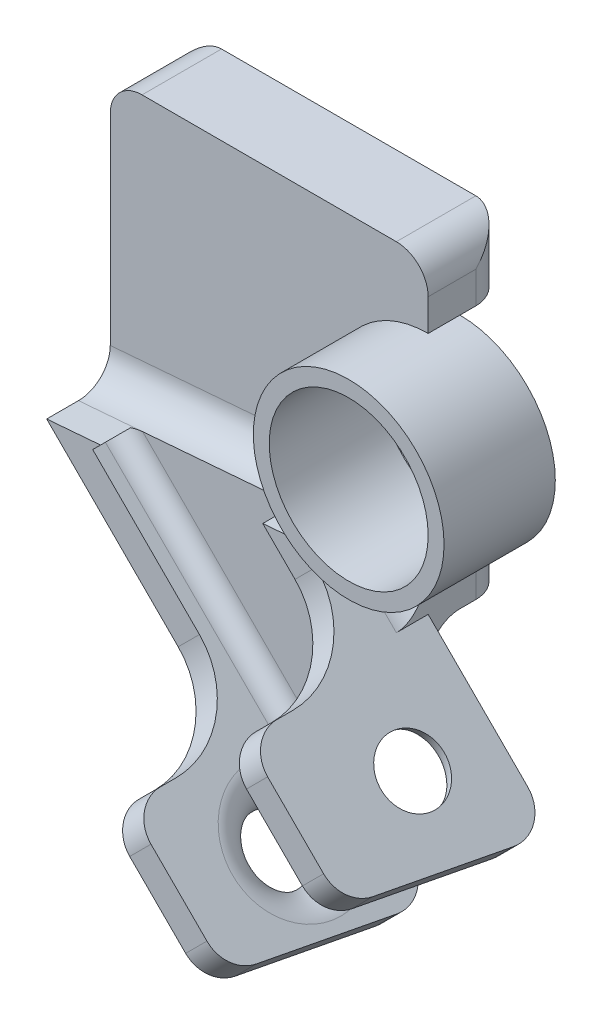
from build123d import *

# Parameters (mm, degrees)
CROQUIS1_R                   = 6
CROQUIS1_R_2                 = 5
SALIENTE_EXTRUIR1_DEPTH      = 7
SALIENTE_EXTRUIR2_DEPTH      = 3
SALIENTE_EXTRUIR2_DEPTH_BACK = 2
CROQUIS4_W                   = 20
CROQUIS4_H                   = 16.5
CORTAR_EXTRUIR1_DEPTH        = 4
SALIENTE_EXTRUIR7_DEPTH      = 4
CORTAR_EXTRUIR4_DEPTH        = 4
CORTAR_EXTRUIR5_DEPTH        = 2.2
SALIENTE_EXTRUIR9_DEPTH      = 8
CORTAR_EXTRUIR6_REACH        = 36.518
CROQUIS13_R                  = 2
REDONDEO1_R                  = 2
CROQUIS14_W                  = 1.8
CROQUIS14_H                  = 8.5
CORTAR_EXTRUIR7_DEPTH        = 10.5
CROQUIS15_W                  = 2
CROQUIS15_H                  = 8.5
CORTAR_EXTRUIR8_DEPTH        = 14.5
REDONDEO2_R                  = 2
REDONDEO3_R                  = 2
REDONDEO4_R                  = 5
CORTAR_EXTRUIR9_REACH        = 36.518
REDONDEO5_R                  = 2
REDONDEO6_R                  = 1.2
SALIENTE_EXTRUIR12_START     = 1
SALIENTE_EXTRUIR12_DEPTH     = 1
SALIENTE_EXTRUIR13_DEPTH     = 3
REDONDEO7_R                  = 2


with BuildPart() as part:
    # Croquis1 → Saliente-Extruir1 (new body)
    with BuildSketch(Plane.XY):
        Circle(CROQUIS1_R)
        Circle(CROQUIS1_R_2, mode=Mode.SUBTRACT)
    extrude(amount=SALIENTE_EXTRUIR1_DEPTH)

    # Croquis2 → Saliente-Extruir2 (add, two sides: drawn at the far end of the back side and taken through both)
    with BuildSketch(Plane(origin=(0, 0, 0), x_dir=(-1, 0, 0), z_dir=(0, 0, -1)).offset(-SALIENTE_EXTRUIR2_DEPTH_BACK)):
        with BuildLine():
            Line((0, -10), (0, -5))
            ThreePointArc((0, -5), (5, 0), (0, 5))
            Line((0, 5), (0, 10))
            Line((0, 10), (20, 10))
            Line((20, 10), (20, -10))
            Line((20, -10), (0, -10))
        make_face()
    extrude(amount=SALIENTE_EXTRUIR2_DEPTH + SALIENTE_EXTRUIR2_DEPTH_BACK)

    # Croquis4 → Cortar-Extruir1 (cut)
    with BuildSketch(Plane(origin=(0, 0, -3), x_dir=(-1, 0, 0), z_dir=(0, 0, -1))):
        with Locations((10, 0)):
            Rectangle(CROQUIS4_W, CROQUIS4_H)
    extrude(amount=-CORTAR_EXTRUIR1_DEPTH, mode=Mode.SUBTRACT)

    # Croquis5 → Saliente-Extruir7 (add)
    with BuildSketch(Plane.XY.offset(2)):
        Polygon((-3.9473557, -5.357801084), (-20, -6.659228144), (0.707205479, -27.366433624), (16.75984978, -26.065006564), align=None)
    extrude(amount=SALIENTE_EXTRUIR7_DEPTH)

    # Croquis10 → Cortar-Extruir4 (cut)
    with BuildSketch(Plane.XY.offset(6)):
        Polygon((-0.765202985, -25.894025159), (7.911832695, -17.216989479), (16.75984978, -26.065006564), (0.707205479, -27.366433624), align=None)
    extrude(amount=-CORTAR_EXTRUIR4_DEPTH, mode=Mode.SUBTRACT)

    # Croquis11 → Cortar-Extruir5 (cut)
    with BuildSketch(Plane.XY.offset(6)):
        Polygon((0.572064306, -24.556757867), (6.582471946, -18.546350227), (-0.842149256, -11.121729025), (-6.852556896, -17.132136665), align=None)
    extrude(amount=-CORTAR_EXTRUIR5_DEPTH, mode=Mode.SUBTRACT)

    # Croquis12 → Saliente-Extruir9 (add)
    with BuildSketch(Plane.XY.offset(6)):
        Polygon((-6.852556896, -17.132136665), (-8.189824188, -18.469403956), (-0.765202985, -25.894025159), (0.572064306, -24.556757867), align=None)
        Polygon((-0.842149256, -11.121729025), (0.487211492, -9.792368276), (7.911832695, -17.216989479), (6.582471946, -18.546350227), align=None)
    extrude(amount=SALIENTE_EXTRUIR9_DEPTH)

    # Cortar-Extruir6: up to this face of the body (flat: up to its plane)
    cortar_extruir6_end = Plane(part.part.faces().sort_by_distance((3.21499462, -12.520151404, 7.335855075))[0])
    # Croquis13 → Cortar-Extruir6 (cut, up to the picked face)
    with BuildSketch(Plane(origin=(-13.329614072, -13.329614072, 0), x_dir=(0, 0, 1), z_dir=(-0.7071067811865488, -0.7071067811865462, 0)), mode=Mode.PRIVATE) as cortar_extruir6_sk1:
        with Locations(Location((7, -12.268760562, 0), (0, 0, 270))):
            Circle(CROQUIS13_R)
    cortar_extruir6_tool1 = split(extrude(cortar_extruir6_sk1.sketch, amount=-CORTAR_EXTRUIR6_REACH, mode=Mode.PRIVATE), bisect_by=cortar_extruir6_end, keep=Keep.BOTH, mode=Mode.PRIVATE)
    add(cortar_extruir6_tool1.solids().sort_by(Axis((-4.65429, -22.004938, 7), (0.7071067811865488, 0.7071067811865462, 0)))[0], mode=Mode.SUBTRACT)

    # Redondeo1
    # the kernel refuses this fillet: 2 mm, written as the material it takes off along each edge
    with BuildSketch(Plane(origin=(-3.31702299, -20.667670571, 7), x_dir=(0.7071067811865459, -0.7071067811865492, 0), z_dir=(0, 0, -1))) as redondeo1_piece_1_section:
        with BuildLine():
            CenterArc((3.997037442, 2), REDONDEO1_R, 183.11895941, 86.88104059)
            Line((2, 1.89118154), (1.960059251, 1.889005171))
            ThreePointArc((1.960059251, 1.889005171), (1.96, 0.94559077), (1.96, 0))
            Line((1.96, 0), (2, -0.04))
            Line((2, -0.04), (3.997037442, -0.04))
            Line((3.997037442, -0.04), (3.997037442, 0))
        make_face()
    redondeo1_piece_1 = revolve(axis=Axis((-3.31702299, -20.667670571, 7), (-0.7071067811865488, -0.7071067811865462, 0)), mode=Mode.PRIVATE)
    redondeo1_piece_1 = split(redondeo1_piece_1, bisect_by=Plane(origin=(-3.31702299, -20.667670571, 3.8), z_dir=(0, 0, 1)), keep=Keep.TOP, mode=Mode.PRIVATE)
    add(redondeo1_piece_1, mode=Mode.SUBTRACT)
    with BuildSketch(Plane(origin=(2.69338465, -14.657262931, 7), x_dir=(0.7071067811865458, -0.7071067811865493, 0), z_dir=(0, 0, -1))) as redondeo1_piece_2_section:
        with BuildLine():
            CenterArc((3.996396754, -2), REDONDEO1_R, 90, 86.560187232)
            Line((3.996396754, 0), (3.996396754, 0.04))
            Line((3.996396754, 0.04), (2, 0.04))
            Line((2, 0.04), (1.96, 0))
            ThreePointArc((1.96, 0), (1.96, -0.94), (1.960072065, -1.8776))
            Line((1.960072065, -1.8776), (2, -1.88))
        make_face()
    redondeo1_piece_2 = revolve(axis=Axis((2.69338465, -14.657262931, 7), (-0.7071067811865488, -0.7071067811865462, 0)), mode=Mode.PRIVATE)
    redondeo1_piece_2 = split(redondeo1_piece_2, bisect_by=Plane(origin=(2.69338465, -14.657262931, 3.8), z_dir=(0, 0, 1)), keep=Keep.TOP, mode=Mode.PRIVATE)
    add(redondeo1_piece_2, mode=Mode.SUBTRACT)

    # Croquis14 → Cortar-Extruir7 (cut)
    with BuildSketch(Plane(origin=(12.564411087, -12.564411087, 0), x_dir=(0, 0, -1), z_dir=(0.7071067811865477, -0.7071067811865474, 0))):
        with Locations((-2.9, -12.709739462)):
            Rectangle(CROQUIS14_W, CROQUIS14_H)
    extrude(amount=-CORTAR_EXTRUIR7_DEPTH, mode=Mode.SUBTRACT)

    # Croquis15 → Cortar-Extruir8 (cut)
    with BuildSketch(Plane(origin=(5.139789884, -5.139789884, 0), x_dir=(0, 0, -1), z_dir=(0.7071067811865476, -0.7071067811865476, 0))):
        with Locations((-5, -12.709739462)):
            Rectangle(CROQUIS15_W, CROQUIS15_H)
    extrude(amount=-CORTAR_EXTRUIR8_DEPTH, mode=Mode.SUBTRACT)

    # Redondeo2
    # the kernel refuses this fillet: 2 mm, written as the material it adds along each edge
    with BuildSketch(Plane(origin=(-21.659228144, -10, 2), x_dir=(0, -1, 0), z_dir=(1, 0, 0))) as redondeo2_piece_1_section:
        with BuildLine():
            CenterArc((REDONDEO2_R, REDONDEO2_R), REDONDEO2_R, 180, 90)
            Line((0, REDONDEO2_R), (0, 0))
            Line((0, 0), (REDONDEO2_R, 0))
        make_face()
    redondeo2_piece_1 = extrude(amount=21.659228144, mode=Mode.PRIVATE)
    redondeo2_piece_1 = split(redondeo2_piece_1, bisect_by=Plane(origin=(-19.159228144, -7.5, 2), z_dir=(0.7071067811865488, 0.7071067811865464, 0)), keep=Keep.TOP, mode=Mode.PRIVATE)
    redondeo2_piece_1 = split(redondeo2_piece_1, bisect_by=Plane(origin=(-10.689824188, -20.969403956, 2), z_dir=(-0.7071067811865477, 0.7071067811865474, 0)), keep=Keep.TOP, mode=Mode.PRIVATE)
    add(redondeo2_piece_1)
    with BuildSketch(Plane(origin=(-21.659228144, -10, 2), x_dir=(0, -1, 0), z_dir=(1, 0, 0))) as redondeo2_piece_2_section:
        with BuildLine():
            CenterArc((REDONDEO2_R, REDONDEO2_R), REDONDEO2_R, 180, 90)
            Line((0, REDONDEO2_R), (0, 0))
            Line((0, 0), (REDONDEO2_R, 0))
        make_face()
    redondeo2_piece_2 = extrude(amount=21.659228144, mode=Mode.PRIVATE)
    redondeo2_piece_2 = split(redondeo2_piece_2, bisect_by=Plane(origin=(-11.811553213, -0.152325068, 2), z_dir=(0.7071067811865476, 0.7071067811865476, 0)), keep=Keep.TOP, mode=Mode.PRIVATE)
    add(redondeo2_piece_2)
    with BuildSketch(Plane(origin=(3.535533906, -12.84069069, 2), x_dir=(0.7071067811865488, 0.7071067811865464, 0), z_dir=(-0.7071067811865464, 0.7071067811865488, 0))) as redondeo2_piece_3_section:
        with BuildLine():
            CenterArc((REDONDEO2_R, -REDONDEO2_R), REDONDEO2_R, 90, 90)
            Line((0, -REDONDEO2_R), (0, 0))
            Line((0, 0), (REDONDEO2_R, 0))
        make_face()
    redondeo2_piece_3 = extrude(amount=15.582403966, mode=Mode.PRIVATE)
    redondeo2_piece_3 = split(redondeo2_piece_3, bisect_by=Plane(origin=(0, -12.84069069, 2), z_dir=(-1, 0, 0)), keep=Keep.TOP, mode=Mode.PRIVATE)
    redondeo2_piece_3 = split(redondeo2_piece_3, bisect_by=Plane(origin=(2.883977199, -4.80396825, 2), z_dir=(0.0808073133091507, -0.9967297417634114, 0)), keep=Keep.TOP, mode=Mode.PRIVATE)
    add(redondeo2_piece_3)
    with BuildSketch(Plane(origin=(1.036293009, -4.953764518, 2), x_dir=(-0.08080731330915071, 0.9967297417634114, 0), z_dir=(-0.9967297417634114, -0.0808073133091507, 0))) as redondeo2_piece_4_section:
        with BuildLine():
            CenterArc((REDONDEO2_R, -REDONDEO2_R), REDONDEO2_R, 90, 90)
            Line((0, -REDONDEO2_R), (0, 0))
            Line((0, 0), (REDONDEO2_R, 0))
        make_face()
    redondeo2_piece_4 = extrude(amount=26.105312832, mode=Mode.PRIVATE)
    redondeo2_piece_4 = split(redondeo2_piece_4, bisect_by=Plane(origin=(-20, -4.953764518, 2), z_dir=(1, 0, 0)), keep=Keep.TOP, mode=Mode.PRIVATE)
    redondeo2_piece_4 = split(redondeo2_piece_4, bisect_by=Plane(origin=(-1.657549628, -7.647607155, 2), z_dir=(-0.7071067811865488, -0.7071067811865464, 0)), keep=Keep.TOP, mode=Mode.PRIVATE)
    add(redondeo2_piece_4)
    with BuildSketch(Plane(origin=(3.535533906, -12.84069069, 2), x_dir=(0.7071067811865488, 0.7071067811865464, 0), z_dir=(-0.7071067811865464, 0.7071067811865488, 0))) as redondeo2_piece_5a_section:
        with BuildLine():
            CenterArc((REDONDEO2_R, -REDONDEO2_R), REDONDEO2_R, 90, 90)
            Line((0, -REDONDEO2_R), (0, 0))
            Line((0, 0), (REDONDEO2_R, 0))
        make_face()
    redondeo2_piece_5a = extrude(amount=15.582403966, mode=Mode.PRIVATE)
    redondeo2_piece_5a = redondeo2_piece_5a - Plane(origin=(0, 0, 2), x_dir=(1, 0, 0), z_dir=(0, 0, -1)) * Cylinder(6, 40, mode=Mode.PRIVATE)
    redondeo2_piece_5a = split(redondeo2_piece_5a, bisect_by=Plane(origin=(2.883977199, -4.80396825, 2), z_dir=(-0.0808073133091507, 0.9967297417634114, 0)), keep=Keep.TOP, mode=Mode.PRIVATE)
    with BuildSketch(Plane(origin=(1.036293009, -4.953764518, 2), x_dir=(-0.08080731330915071, 0.9967297417634114, 0), z_dir=(-0.9967297417634114, -0.0808073133091507, 0))) as redondeo2_piece_5b_section:
        with BuildLine():
            CenterArc((REDONDEO2_R, -REDONDEO2_R), REDONDEO2_R, 90, 90)
            Line((0, -REDONDEO2_R), (0, 0))
            Line((0, 0), (REDONDEO2_R, 0))
        make_face()
    redondeo2_piece_5b = extrude(amount=26.105312832, mode=Mode.PRIVATE)
    redondeo2_piece_5b = redondeo2_piece_5b - Plane(origin=(0, 0, 2), x_dir=(1, 0, 0), z_dir=(0, 0, -1)) * Cylinder(6, 61, mode=Mode.PRIVATE)
    redondeo2_piece_5b = split(redondeo2_piece_5b, bisect_by=Plane(origin=(-1.657549628, -7.647607155, 2), z_dir=(0.7071067811865488, 0.7071067811865464, 0)), keep=Keep.TOP, mode=Mode.PRIVATE)
    redondeo2_piece_5 = redondeo2_piece_5a & redondeo2_piece_5b
    add(redondeo2_piece_5)

    # Redondeo3
    redondeo3_edges = [part.edges().sort_by_distance(p)[0] for p in [
        (-18.329614072, -8.329614072, 2),
    ]]
    fillet(redondeo3_edges, radius=REDONDEO3_R)

    # Redondeo4
    redondeo4_edges = [part.edges().sort_by_distance(p)[0] for p in [
        (-7.521190542, -17.800770311, 6),
        (-0.177468882, -10.457048651, 6),
    ]]
    fillet(redondeo4_edges, radius=REDONDEO4_R)

    # Cortar-Extruir9: up to this face of the body (flat: up to its plane)
    cortar_extruir9_end = Plane(part.part.faces().sort_by_distance((-3.497839057, -5.807317727, 5.793776651))[0])
    # Croquis16 → Cortar-Extruir9 (cut, up to the picked face)
    with BuildSketch(Plane(origin=(-13.329614072, -13.329614072, 0), x_dir=(0, 0, 1), z_dir=(-0.7071067811865488, -0.7071067811865462, 0)), mode=Mode.PRIVATE) as cortar_extruir9_sk1:
        Polygon((2, -17.768760562), (14, -15.968760562), (14, -17.768760562), align=None)
    cortar_extruir9_tool1 = split(extrude(cortar_extruir9_sk1.sketch, amount=-CORTAR_EXTRUIR9_REACH, mode=Mode.PRIVATE), bisect_by=cortar_extruir9_end, keep=Keep.BOTH, mode=Mode.PRIVATE)
    add(cortar_extruir9_tool1.solids().sort_by(Axis((-1.189467, -25.469761, 10), (0.7071067811865488, 0.7071067811865462, 0)))[0], mode=Mode.SUBTRACT)

    # Redondeo5
    redondeo5_edges = [part.edges().sort_by_distance(p)[0] for p in [
        (-7.521190542, -17.800770311, 14),
        (-0.177468882, -10.457048651, 14),
        (-0.09656934, -25.225391513, 2),
        (-1.369361546, -23.952599307, 14),
        (5.974360114, -16.608877647, 14),
        (7.24715232, -17.881669853, 2),
    ]]
    fillet(redondeo5_edges, radius=REDONDEO5_R)

    # Redondeo6
    # the kernel refuses this fillet: 1.2 mm, written as the material it adds along each edge
    with BuildSketch(Plane(origin=(-6.852556896, -17.132136665, 4), x_dir=(0.7071067811865482, -0.7071067811865468, 0), z_dir=(0, 0, -1))) as redondeo6_piece_1:
        with BuildLine():
            CenterArc((REDONDEO6_R, -REDONDEO6_R), REDONDEO6_R, 90, 90)
            Line((0, -REDONDEO6_R), (0, 0))
            Line((0, 0), (REDONDEO6_R, 0))
        make_face()
    extrude(amount=2)
    with BuildSketch(Plane(origin=(-0.842149256, -11.121729025, -1.2031583), x_dir=(-0.7071067811865542, -0.7071067811865409, -7.347476233374363e-14), z_dir=(0, 0, 1))) as redondeo6_piece_2_section:
        with BuildLine():
            CenterArc((REDONDEO6_R, REDONDEO6_R), REDONDEO6_R, 180, 90)
            Line((0, REDONDEO6_R), (0, 0))
            Line((0, 0), (REDONDEO6_R, 0))
        make_face()
    redondeo6_piece_2 = extrude(amount=5.2031583, mode=Mode.PRIVATE)
    redondeo6_piece_2 = redondeo6_piece_2 - Plane(origin=(-0.842149256, -12, 0), x_dir=(0, -1, 0), z_dir=(-1, 0, 0)) * Cylinder(2, 16, mode=Mode.PRIVATE)
    redondeo6_piece_2 = split(redondeo6_piece_2, bisect_by=Plane(origin=(0, -11.121729025, -1.2031583), z_dir=(-1, 0, 0)), keep=Keep.TOP, mode=Mode.PRIVATE)
    add(redondeo6_piece_2)
    with BuildSketch(Plane(origin=(-0.842149256, -11.121729025, -1.2031583), x_dir=(-0.7071067811865542, -0.7071067811865409, -7.347476233374363e-14), z_dir=(0, 0, 1))) as redondeo6_piece_3_section:
        with BuildLine():
            CenterArc((REDONDEO6_R, REDONDEO6_R), REDONDEO6_R, 180, 90)
            Line((0, REDONDEO6_R), (0, 0))
            Line((0, 0), (REDONDEO6_R, 0))
        make_face()
    redondeo6_piece_3 = extrude(amount=5.2031583, mode=Mode.PRIVATE)
    redondeo6_piece_3 = split(redondeo6_piece_3, bisect_by=Plane(origin=(-0.842149256, -11.121729025, 2), z_dir=(0, 0, 1)), keep=Keep.TOP, mode=Mode.PRIVATE)
    add(redondeo6_piece_3)
    with BuildSketch(Plane(origin=(-6.852556896, -17.132136665, 4), x_dir=(0, 0, 1), z_dir=(-0.7071067811865476, 0.7071067811865476, 0))) as redondeo6_piece_4_section:
        with BuildLine():
            CenterArc((REDONDEO6_R, REDONDEO6_R), REDONDEO6_R, 180, 90)
            Line((0, REDONDEO6_R), (0, 0))
            Line((0, 0), (REDONDEO6_R, 0))
        make_face()
    redondeo6_piece_4 = extrude(amount=17.5, mode=Mode.PRIVATE)
    redondeo6_piece_4 = split(redondeo6_piece_4, bisect_by=Plane(origin=(-7.781927379, -5.668679171, 4), z_dir=(0.08080731330903411, -0.9967297417634209, 0)), keep=Keep.TOP, mode=Mode.PRIVATE)
    add(redondeo6_piece_4)
    with BuildSketch(Plane(origin=(-0.842149256, -11.121729025, 4), x_dir=(0, 0, 1), z_dir=(-0.7071067811865476, 0.7071067811865476, 0))) as redondeo6_piece_5_section:
        with BuildLine():
            CenterArc((REDONDEO6_R, -REDONDEO6_R), REDONDEO6_R, 90, 90)
            Line((0, -REDONDEO6_R), (0, 0))
            Line((0, 0), (REDONDEO6_R, 0))
        make_face()
    redondeo6_piece_5 = extrude(amount=10.869452862, mode=Mode.PRIVATE)
    redondeo6_piece_5 = split(redondeo6_piece_5, bisect_by=Plane(origin=(-1.326670052, -5.145335701, 4), z_dir=(0.08080731330903411, -0.9967297417634209, 0)), keep=Keep.TOP, mode=Mode.PRIVATE)
    add(redondeo6_piece_5)
    with BuildSketch(Plane(origin=(-6.852556896, -17.132136665, 7), x_dir=(0.7071067811865482, -0.7071067811865468, 0), z_dir=(0, 0, -1))) as redondeo6_piece_6a_section:
        with BuildLine():
            CenterArc((REDONDEO6_R, -REDONDEO6_R), REDONDEO6_R, 90, 90)
            Line((0, -REDONDEO6_R), (0, 0))
            Line((0, 0), (REDONDEO6_R, 0))
        make_face()
    redondeo6_piece_6a = extrude(amount=5, mode=Mode.PRIVATE)
    redondeo6_piece_6a = split(redondeo6_piece_6a, bisect_by=Plane(origin=(-6.852556896, -17.132136665, 4), z_dir=(0, 0, 1)), keep=Keep.TOP, mode=Mode.PRIVATE)
    with BuildSketch(Plane(origin=(-4.731236553, -19.253457008, 4), x_dir=(0, 0, 1), z_dir=(-0.7071067811865476, 0.7071067811865476, 0))) as redondeo6_piece_6b_section:
        with BuildLine():
            CenterArc((REDONDEO6_R, REDONDEO6_R), REDONDEO6_R, 180, 90)
            Line((0, REDONDEO6_R), (0, 0))
            Line((0, 0), (REDONDEO6_R, 0))
        make_face()
    redondeo6_piece_6b = extrude(amount=17.5, mode=Mode.PRIVATE)
    redondeo6_piece_6b = split(redondeo6_piece_6b, bisect_by=Plane(origin=(-6.852556896, -17.132136665, 4), z_dir=(0.7071067811865476, -0.7071067811865476, 0)), keep=Keep.TOP, mode=Mode.PRIVATE)
    redondeo6_piece_6 = redondeo6_piece_6a & redondeo6_piece_6b
    add(redondeo6_piece_6)
    with BuildSketch(Plane(origin=(-0.842149256, -11.121729025, -1.2031583), x_dir=(-0.7071067811865542, -0.7071067811865409, -7.347476233374363e-14), z_dir=(0, 0, 1))) as redondeo6_piece_7a_section:
        with BuildLine():
            CenterArc((REDONDEO6_R, REDONDEO6_R), REDONDEO6_R, 180, 90)
            Line((0, REDONDEO6_R), (0, 0))
            Line((0, 0), (REDONDEO6_R, 0))
        make_face()
    redondeo6_piece_7a = extrude(amount=8.2031583, mode=Mode.PRIVATE)
    redondeo6_piece_7a = split(redondeo6_piece_7a, bisect_by=Plane(origin=(-0.842149256, -11.121729025, 4), z_dir=(0, 0, 1)), keep=Keep.TOP, mode=Mode.PRIVATE)
    with BuildSketch(Plane(origin=(1.279171087, -13.243049368, 4), x_dir=(0, 0, 1), z_dir=(-0.7071067811865476, 0.7071067811865476, 0))) as redondeo6_piece_7b_section:
        with BuildLine():
            CenterArc((REDONDEO6_R, -REDONDEO6_R), REDONDEO6_R, 90, 90)
            Line((0, -REDONDEO6_R), (0, 0))
            Line((0, 0), (REDONDEO6_R, 0))
        make_face()
    redondeo6_piece_7b = extrude(amount=13.869452862, mode=Mode.PRIVATE)
    redondeo6_piece_7b = split(redondeo6_piece_7b, bisect_by=Plane(origin=(-0.842149256, -11.121729025, 4), z_dir=(0.7071067811865476, -0.7071067811865476, 0)), keep=Keep.TOP, mode=Mode.PRIVATE)
    redondeo6_piece_7 = redondeo6_piece_7a & redondeo6_piece_7b
    add(redondeo6_piece_7)

    # Croquis20 → Saliente-Extruir12 (add)
    with BuildSketch(Plane(origin=(0, 0, 1), x_dir=(-1, 0, 0), z_dir=(0, 0, -1)).offset(SALIENTE_EXTRUIR12_START)):
        with BuildLine():
            Line((0, -8.25), (20, -8.25))
            Line((20, -8.25), (20, 8.25))
            Line((20, 8.25), (0, 8.25))
            Line((0, 8.25), (0, 6))
            Line((0, 6), (0, 5))
            ThreePointArc((0, 5), (5, 0), (0, -5))
            Line((0, -5), (0, -6))
            Line((0, -6), (0, -8.25))
        make_face()
    extrude(amount=-SALIENTE_EXTRUIR12_DEPTH)

    # Croquis21 → Saliente-Extruir13 (add)
    with BuildSketch(Plane(origin=(0, 0, 0), x_dir=(-1, 0, 0), z_dir=(0, 0, -1))):
        Polygon((0, -8.25), (20, -8.25), (20, -4.25), (0, -6), align=None)
        Polygon((0, 6), (20, 7.45), (20, 8.25), (0, 8.25), align=None)
    extrude(amount=SALIENTE_EXTRUIR13_DEPTH)

    # Redondeo7
    redondeo7_edges = [part.edges().sort_by_distance(p)[0] for p in [
        (-20, -10, -0.5),
        (-20, 10, -0.5),
        (-20, 8.725, -3),
        (-20, -7.125, -3),
        (0, -8, -3),
        (0, 8, -3),
        (0, 10, -0.5),
    ]]
    fillet(redondeo7_edges, radius=REDONDEO7_R)


solid = part.part
